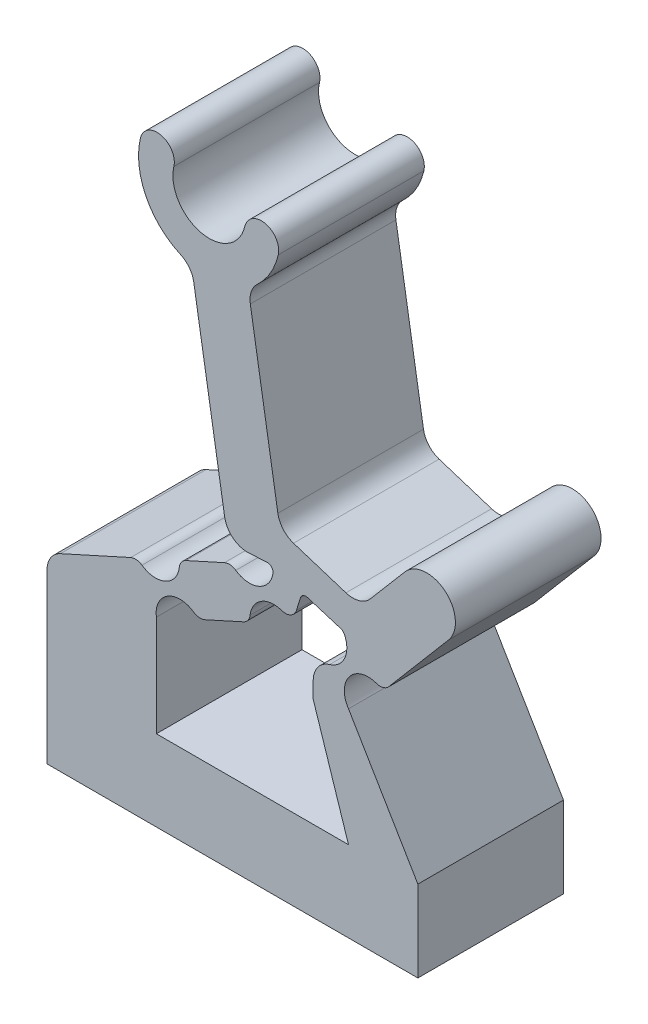
from build123d import *

# Parameters (mm, degrees)
BOSS_CONFIGUP_DEPTH = 6.35
FILLET1_R           = 1
FILLET2_R           = 1
FILLET3_R           = 0.5
FILLET4_R           = 0.25


with BuildPart() as part:
    # Sketch-ConfigUp → Boss-ConfigUp (new body)
    with BuildSketch(Plane.XY):
        with BuildLine():
            Line((8.036884771, -1.932633536), (5.768256233, -2.958998264))
            ThreePointArc((5.768256233, -2.958998264), (5.166306437, -4.054514783), (3.946064636, -3.783387604))
            Line((3.946064636, -3.783387604), (0, -5.568651912))
            Line((0, -5.568651912), (0, -13.535586773))
            Line((0, -13.535586773), (13.148184343, -13.535586773))
            Line((13.148184343, -13.535586773), (16.174076401, -13.535586773))
            Line((16.174076401, -13.535586773), (16.174076401, -9.99042666))
            Line((16.174076401, -9.99042666), (13.148184343, -4.879193769))
            ThreePointArc((13.148184343, -4.879193769), (13.293740037, -3.530244077), (14.649156385, -3.469430814))
            Line((14.649156385, -3.469430814), (17.513873441, -0.098510164))
            ThreePointArc((17.513873441, -0.098510164), (17.370838202, 1.663460585), (15.608867453, 1.520425346))
            Line((15.608867453, 1.520425346), (13.671985925, -0.758708619))
            Line((13.671985925, -0.758708619), (10.167849035, 0.35963163))
            Line((10.167849035, 0.35963163), (8.77136122, 8.849335746))
            ThreePointArc((8.77136122, 8.849335746), (9.609835457, 9.662661067), (10.086138806, 10.729278263))
            ThreePointArc((10.086138806, 10.729278263), (9.52657217, 11.630324976), (8.625525457, 11.07075834))
            ThreePointArc((8.625525457, 11.07075834), (6.718309914, 9.886342294), (5.533893867, 11.793557837))
            ThreePointArc((5.533893867, 11.793557837), (4.974327231, 12.69460455), (4.073280517, 12.135037914))
            ThreePointArc((4.073280517, 12.135037914), (4.437375542, 9.835058641), (6.304511976, 8.443558952))
            Line((6.304511976, 8.443558952), (7.894275956, -1.221133903))
            Line((7.894275956, -1.221133903), (9.859076368, -1.108244196))
            ThreePointArc((9.859076368, -1.108244196), (9.257126572, -2.203760715), (8.036884771, -1.932633536))
        make_face()
        with BuildLine():
            Line((8.861274111, -3.754825133), (6.592645572, -4.781189861))
            ThreePointArc((6.592645572, -4.781189861), (5.372403771, -4.510062682), (4.770453975, -5.605579201))
            Line((4.770453975, -5.605579201), (4.770453975, -10.013562907))
            Line((4.770453975, -10.013562907), (6.154904632, -10.013562907))
            Line((6.154904632, -10.013562907), (11.609562951, -10.013562907))
            Line((11.609562951, -10.013562907), (13.148184343, -10.013562907))
            Line((13.148184343, -10.013562907), (11.609562951, -5.290275252))
            Line((11.609562951, -5.290275252), (11.609562951, -3.571623701))
            ThreePointArc((11.609562951, -3.571623701), (12.828638952, -3.295301959), (12.904711359, -2.047618911))
            Line((12.904711359, -2.047618911), (11.125056051, -1.498714265))
            Line((11.125056051, -1.498714265), (10.683465708, -2.930435793))
            ThreePointArc((10.683465708, -2.930435793), (9.463223907, -2.659308614), (8.861274111, -3.754825133))
        make_face(mode=Mode.SUBTRACT)
    extrude(amount=BOSS_CONFIGUP_DEPTH)

    # Fillet1
    fillet1_edges = [part.edges().sort_by_distance(p)[0] for p in [
        (8.77136122, 8.849335746, 3.175),
        (6.304511976, 8.443558952, 3.175),
        (0, -5.568651912, 3.175),
        (13.671985925, -0.758708619, 3.175),
        (10.167849035, 0.35963163, 3.175),
        (7.894275956, -1.221133903, 3.175),
    ]]
    fillet(fillet1_edges, radius=FILLET1_R)

    # Fillet2
    fillet2_edges = [part.edges().sort_by_distance(p)[0] for p in [
        (11.609562951, -3.571623701, 3.175),
    ]]
    fillet(fillet2_edges, radius=FILLET2_R)

    # Fillet3
    fillet3_edges = [part.edges().sort_by_distance(p)[0] for p in [
        (14.649156385, -3.469430814, 3.175),
        (3.946064636, -3.783387604, 3.175),
        (6.592645572, -4.781189861, 3.175),
        (8.861274111, -3.754825133, 3.175),
        (8.036884771, -1.932633536, 3.175),
        (5.768256233, -2.958998264, 3.175),
        (10.683465708, -2.930435793, 3.175),
    ]]
    fillet(fillet3_edges, radius=FILLET3_R)

    # Fillet4
    fillet4_edges = [part.edges().sort_by_distance(p)[0] for p in [
        (9.859076368, -1.108244196, 3.175),
        (12.904711359, -2.047618911, 3.175),
        (11.125056051, -1.498714265, 3.175),
    ]]
    fillet(fillet4_edges, radius=FILLET4_R)


solid = part.part
